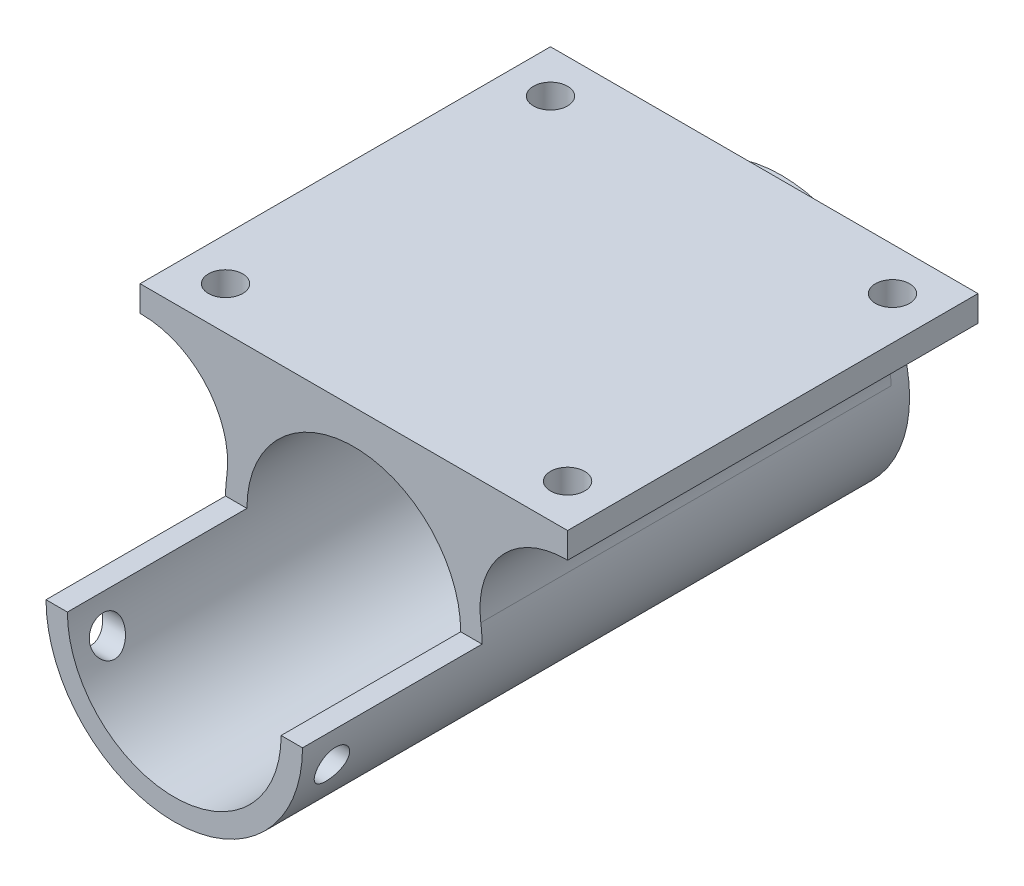
from build123d import *
from build123d.topology import SkipClean

# Parameters (mm, degrees)
SKETCH1_R               = 12.5
BOSS_EXTRUDE1_DEPTH     = 48
BOSS_EXTRUDE3_START     = 2
SKETCH3_R               = 15
SKETCH3_R_2             = 11
BOSS_EXTRUDE3_DEPTH     = 2
SKETCH4_R               = 2
CUT_EXTRUDE1_DEPTH      = 63.623877738
BOSS_EXTRUDE4_DEPTH     = 21
CUT_EXTRUDE2_DEPTH      = 76.223081372
CUT_EXTRUDE2_DEPTH_BACK = 76.223081372
SKETCH7_R               = 2


with BuildPart() as part:
    # Sketch1 → Boss-Extrude1 (new body)
    with BuildSketch(Plane.XY):
        with BuildLine():
            Line((24.754908454, 13.492063492), (25, 13.492063492))
            Line((25, 13.492063492), (25, 16.507936508))
            Line((25, 16.507936508), (-25, 16.507936508))
            Line((-25, 16.507936508), (-25, 13.492063492))
            Line((-25, 13.492063492), (-24.754908454, 13.492063492))
            ThreePointArc((-24.754908454, 13.492063492), (-17.206125308, 10.050712211), (-14.852945072, 2.095238095))
            ThreePointArc((-14.852945072, 2.095238095), (0, -15), (14.852945072, 2.095238095))
            ThreePointArc((14.852945072, 2.095238095), (17.206125308, 10.050712211), (24.754908454, 13.492063492))
        make_face()
        Circle(SKETCH1_R, mode=Mode.SUBTRACT)
    extrude(amount=BOSS_EXTRUDE1_DEPTH)

    # Sketch3 → Boss-Extrude3 (add)
    with BuildSketch(Plane(origin=(0, 0, 0), x_dir=(-1, 0, 0), z_dir=(0, 0, -1)).offset(BOSS_EXTRUDE3_START)):
        Circle(SKETCH3_R)
        Circle(SKETCH3_R_2, mode=Mode.SUBTRACT)
    extrude(amount=-BOSS_EXTRUDE3_DEPTH)

    # Sketch4 → Cut-Extrude1 (cut, through all)
    with BuildSketch(Plane(origin=(0, 16.507936508, 0), x_dir=(1, 0, 0), z_dir=(0, 1, 0))):
        with Locations((-20, -5)):
            Circle(SKETCH4_R)
        with Locations((20, -5)):
            Circle(SKETCH4_R)
        with Locations((20, -43)):
            Circle(SKETCH4_R)
        with Locations((-20, -43)):
            Circle(SKETCH4_R)
    extrude(amount=-CUT_EXTRUDE1_DEPTH, mode=Mode.SUBTRACT)

    # Sketch5 → Boss-Extrude4 (add)
    with SkipClean():  # the faces are left unmerged after this step: merging them gives an invalid solid
        with BuildSketch(Plane.XY.offset(48)):
            with BuildLine():
                Line((-15, 0), (-12.5, 0))
                ThreePointArc((-12.5, 0), (0, -12.5), (12.5, 0))
                Line((12.5, 0), (15, 0))
                ThreePointArc((15, 0), (0, -15), (-15, 0))
            make_face()
        extrude(amount=BOSS_EXTRUDE4_DEPTH)

    # Sketch7 → Cut-Extrude2 (cut, two sides: drawn at the far end of the back side and taken through both)
    with SkipClean():  # the faces are left unmerged after this step: merging them gives an invalid solid
        with BuildSketch(Plane(origin=(0, 0, 0), x_dir=(0, 0, -1), z_dir=(1, 0, 0)).offset(-CUT_EXTRUDE2_DEPTH_BACK)):
            with Locations((-65, -4)):
                Circle(SKETCH7_R)
        extrude(amount=CUT_EXTRUDE2_DEPTH + CUT_EXTRUDE2_DEPTH_BACK, mode=Mode.SUBTRACT)


solid = part.part
